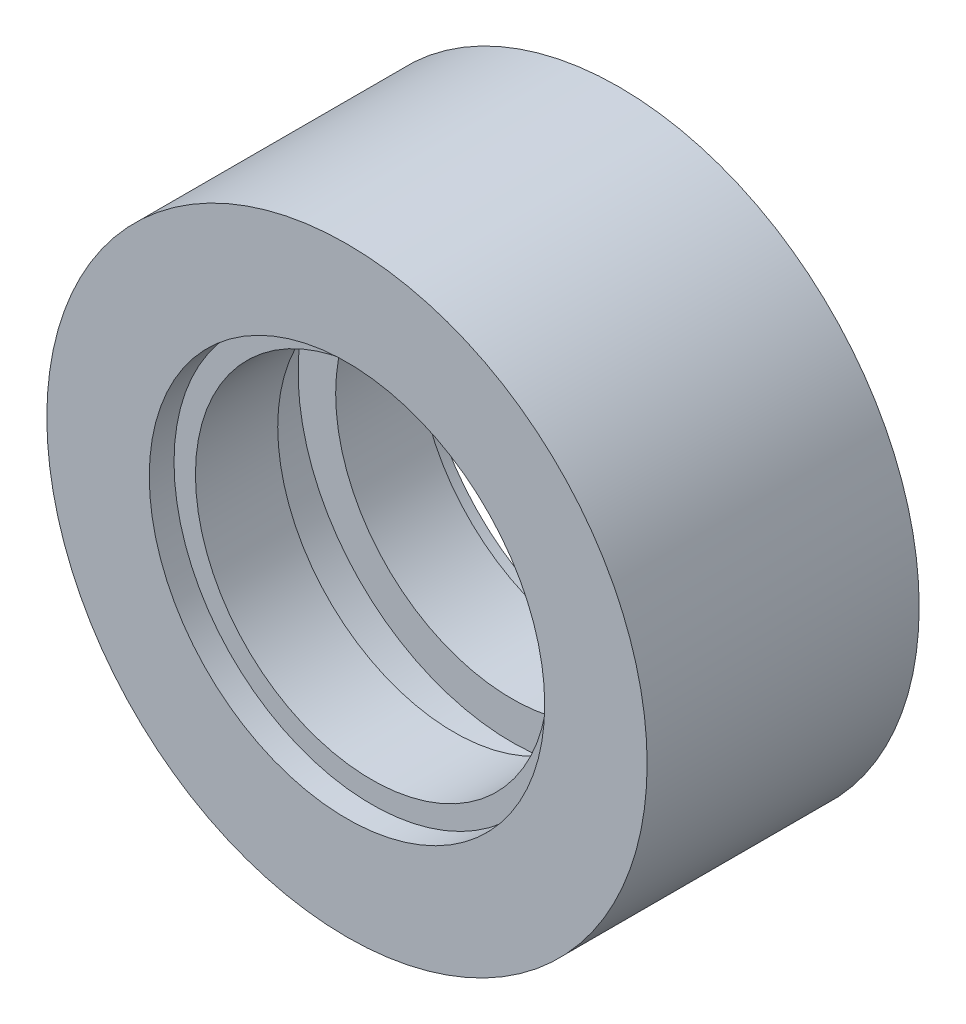
from build123d import *

# Parameters (mm, degrees)
SZKIC1_R                    = 14.3
DODANIE_WYCI_GNI_CIE1_DEPTH = 12.96
WYTNIJ_WYCI_GNI_CIE1_REACH  = 26.02
SZKIC2_R                    = 8.4
SZKIC3_R                    = 9.42
WYTNIJ_WYCI_GNI_CIE2_DEPTH  = 1.18
SZKIC5_R                    = 10.19
WYTNIJ_WYCI_GNI_CIE3_DEPTH  = 1.38


with BuildPart() as part:
    # Szkic1 → Dodanie-wyciągnięcie1 (new body)
    with BuildSketch(Plane.XY):
        Circle(SZKIC1_R)
    extrude(amount=DODANIE_WYCI_GNI_CIE1_DEPTH)

    # Szkic2 → Wytnij-wyciągnięcie1 (cut, up to next)
    with BuildSketch(Plane.XY.offset(12.96), mode=Mode.PRIVATE) as wytnij_wyci_gni_cie1_sk1:
        Circle(SZKIC2_R)
    wytnij_wyci_gni_cie1_tool1 = extrude(wytnij_wyci_gni_cie1_sk1.sketch, amount=-WYTNIJ_WYCI_GNI_CIE1_REACH, mode=Mode.PRIVATE) & part.part
    add(wytnij_wyci_gni_cie1_tool1.solids().sort_by_distance((0, 0, 12.96))[0], mode=Mode.SUBTRACT)

    # Szkic3 → Wytnij-wyciągnięcie2 (cut)
    with BuildSketch(Plane.XY.offset(12.96)):
        Circle(SZKIC3_R)
    wytnij_wyci_gni_cie2 = extrude(amount=-WYTNIJ_WYCI_GNI_CIE2_DEPTH, mode=Mode.SUBTRACT)

    # Lustro1: Wytnij-wyciągnięcie2 across plane
    add(wytnij_wyci_gni_cie2.mirror(Plane.XY.offset(6.48)), mode=Mode.SUBTRACT)

    # Szkic5 → Wytnij-wyciągnięcie3 (cut, symmetric)
    with BuildSketch(Plane.XY.offset(6.48)):
        Circle(SZKIC5_R)
    extrude(amount=WYTNIJ_WYCI_GNI_CIE3_DEPTH, both=True, mode=Mode.SUBTRACT)


solid = part.part
